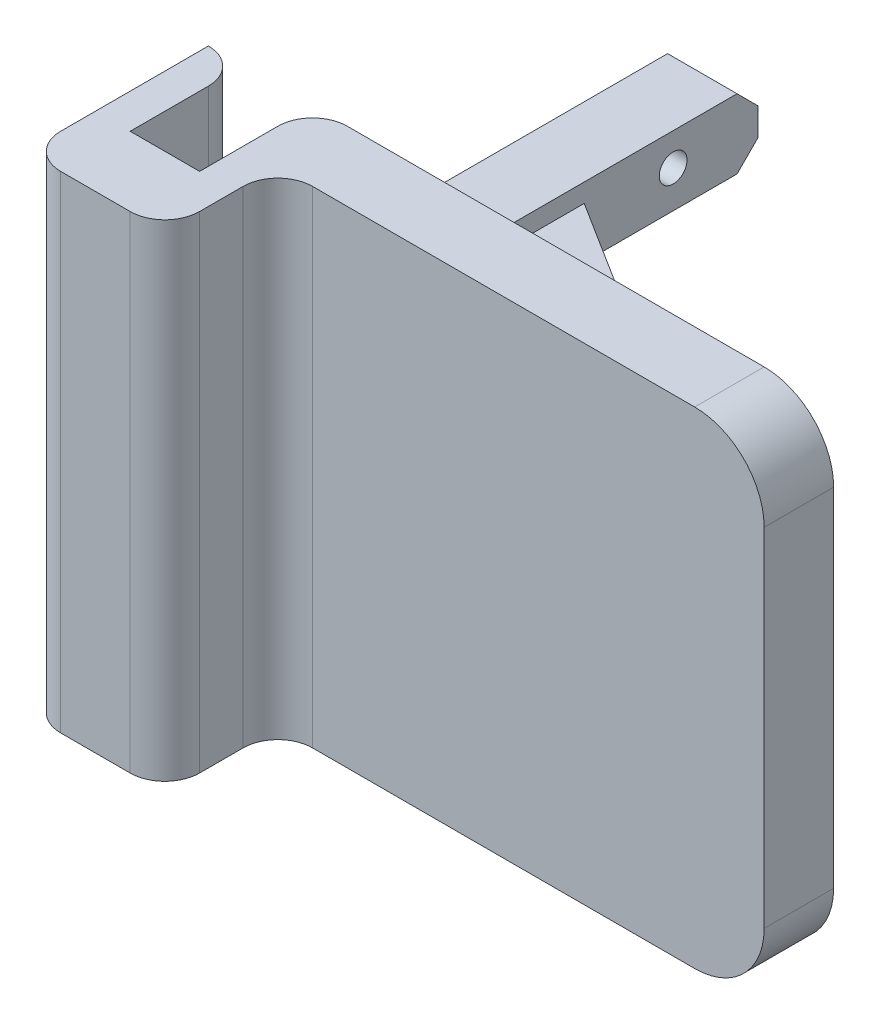
from build123d import *

# Parameters (mm, degrees)
ESQUISSE1_W             = 35
ESQUISSE1_H             = 35
BOSS_EXTRU_1_DEPTH      = 5
BOSS_EXTRU_2_DEPTH      = 13.13
ESQUISSE3_W             = 5
ESQUISSE3_H             = 35
BOSS_EXTRU_3_DEPTH      = 5
BOSS_EXTRU_4_START      = -19.05
ESQUISSE4_W             = 20.5
ESQUISSE4_H             = 4.65
BOSS_EXTRU_4_DEPTH      = 5
BOSS_EXTRU_5_START      = 27.4
ESQUISSE5_W             = 5
ESQUISSE5_H             = 20.5
BOSS_EXTRU_5_DEPTH      = 5
BOSS_EXTRU_6_START      = -1.1625
BOSS_EXTRU_6_DEPTH      = 2.325
BOSS_EXTRU_7_START      = 27.225
BOSS_EXTRU_7_DEPTH      = 2.325
CONG_3_R                = 5
CONG_4_R                = 1.3
CONG_5_R                = 5
ESQUISSE8_R             = 1
ENL_V_MAT_EXTRU_1_DEPTH = 38.415270946
CHANFREIN1_SIZE         = 1.5
CONG_6_R                = 5
CONG_7_R                = 2.5
CONG_8_R                = 2.5
CONG_9_R                = 2.5
ESQUISSE9_R             = 1.5
ENL_V_MAT_EXTRU_2_DEPTH = 51.326434406


# Some blends are built 0.0001 mm under size
with BuildPart() as part:
    # Esquisse1 → Boss.-Extru.1 (new body)
    with BuildSketch(Plane.XY):
        Rectangle(ESQUISSE1_W, ESQUISSE1_H)
    extrude(amount=BOSS_EXTRU_1_DEPTH)

    # Esquisse2 → Boss.-Extru.2 (add)
    with BuildSketch(Plane(origin=(0, 0, 0), x_dir=(-1, 0, 0), z_dir=(0, 0, -1))):
        Polygon((25, 15), (25, -15), (25, -17.5), (27.5, -17.5), (27.5, 17.5), (25, 17.5), align=None)
        Polygon((17.5, 17.5), (17.5, -17.5), (20, -17.5), (20, -15), (20, 15), (20, 17.5), align=None)
    extrude(amount=-BOSS_EXTRU_2_DEPTH)


with BuildPart() as boss_extru_2_piece_1:
    # of the separate pieces the step leaves, piece 1, a body of its own (boss_extru_2_pieces)
    add(part.part.solids().sort_by_distance((17.5, 17.5, 0))[0])



with BuildPart() as boss_extru_2_piece_2:
    # of the separate pieces the step leaves, piece 2, a body of its own (boss_extru_2_pieces)
    add(part.part.solids().sort_by_distance((-25, 17.5, 0))[0])


with BuildPart() as boss_extru_2_piece_1_1:
    add(boss_extru_2_piece_1.part)

    add(boss_extru_2_piece_2.part)  # Boss.-Extru.3 merges Boss.-Extru.2 piece 2
    # Esquisse3 → Boss.-Extru.3 (add)
    with BuildSketch(Plane.ZY.offset(20)):
        with Locations((10.63, 0)):
            Rectangle(ESQUISSE3_W, ESQUISSE3_H)
    extrude(amount=BOSS_EXTRU_3_DEPTH)

    # Esquisse4 → Boss.-Extru.4 (add)
    with BuildSketch(Plane.ZY.offset(27.5).offset(BOSS_EXTRU_4_START)):
        with Locations((-10.25, -15.175)):
            Rectangle(ESQUISSE4_W, ESQUISSE4_H)
    extrude(amount=BOSS_EXTRU_4_DEPTH)

    # Esquisse5 → Boss.-Extru.5 (add)
    with BuildSketch(Plane(origin=(0, -12.85, 0), x_dir=(1, 0, 0), z_dir=(0, 1, 0)).offset(BOSS_EXTRU_5_START)):
        with Locations((-10.95, 10.25)):
            Rectangle(ESQUISSE5_W, ESQUISSE5_H)
    extrude(amount=-BOSS_EXTRU_5_DEPTH)

    # Esquisse6 → Boss.-Extru.6 (add)
    with BuildSketch(Plane.XZ.offset(17.5).offset(BOSS_EXTRU_6_START)):
        Polygon((-8.45, -8), (4.23857754, 0), (-8.45, 0), align=None)
    extrude(amount=-BOSS_EXTRU_6_DEPTH)

    # Esquisse7 → Boss.-Extru.7 (add)
    with BuildSketch(Plane(origin=(0, -14.0125, 0), x_dir=(1, 0, 0), z_dir=(0, 1, 0)).offset(BOSS_EXTRU_7_START)):
        Polygon((-8.45, 8), (-8.45, 0), (4.23857754, 0), align=None)
    extrude(amount=-BOSS_EXTRU_7_DEPTH)

    # Congé3
    # the kernel refuses this fillet: 5 mm, written as the material it adds along each edge
    with BuildSketch(Plane(origin=(12.251689354, -16.3375, 0), x_dir=(0, -1, 0), z_dir=(-1, 0, 0))) as cong_3_piece_1_section:
        with BuildLine():
            CenterArc((5, -3.205244725), CONG_3_R, 140.129918766, 39.870081234)
            Line((0, -3.205244725), (0, 0))
            Line((0, 0), (1.1625, 0))
        make_face()
    cong_3_piece_1 = extrude(amount=20.701689354, mode=Mode.PRIVATE)
    cong_3_piece_1 = split(cong_3_piece_1, bisect_by=Plane(origin=(-0.976512405, -16.627700283, -3.288053324), z_dir=(-0.5333333333333334, 0, 0.8459051693633013)), keep=Keep.TOP, mode=Mode.PRIVATE)
    add(cong_3_piece_1)

    # Congé4
    cong_4_edges = [boss_extru_2_piece_1_1.edges().sort_by_distance(p)[0] for p in [
        (-2.10571123, 13.2125, 0),
    ]]
    fillet(cong_4_edges, radius=CONG_4_R)

    # Congé5
    cong_5_edges = [boss_extru_2_piece_1_1.edges().sort_by_distance(p)[0] for p in [
        (17.5, -17.5, 2.5),
        (17.5, 17.5, 2.5),
    ]]
    fillet(cong_5_edges, radius=CONG_5_R)

    # Esquisse8 → Enlèv. mat.-Extru.1 (cut, through all)
    with BuildSketch(Plane(origin=(-8.45, 0, 0), x_dir=(0, 0, -1), z_dir=(1, 0, 0))):
        with Locations(Location((14.4, 12.225, 0), (0, 0, 90))):
            Circle(ESQUISSE8_R)
        with Locations(Location((14.4, -15.175, 0), (0, 0, 90))):
            Circle(ESQUISSE8_R)
    extrude(amount=-ENL_V_MAT_EXTRU_1_DEPTH, mode=Mode.SUBTRACT)

    # Chanfrein1
    chanfrein1_edges = [boss_extru_2_piece_1_1.edges().sort_by_distance(p)[0] for p in [
        (-10.95, -12.85, -20.5),
        (-10.95, -17.5, -20.5),
        (-10.95, 9.55, -20.5),
        (-10.95, 14.55, -20.5),
    ]]
    chamfer(chanfrein1_edges, length=CHANFREIN1_SIZE)

    # Congé6
    cong_6_edges = [boss_extru_2_piece_1_1.edges().sort_by_distance(p)[0] for p in [
        (-10.95, -12.85, 0),
        (-10.95, 9.55, 0),
    ]]
    fillet(cong_6_edges, radius=CONG_6_R)

    # Congé7
    cong_7_edges = [boss_extru_2_piece_1_1.edges().sort_by_distance(p)[0] for p in [
        (-17.5, 0, 13.13),
        (-27.5, 0, 13.13),
    ]]
    fillet(cong_7_edges, radius=CONG_7_R)

    # Congé8
    cong_8_edges = [boss_extru_2_piece_1_1.edges().sort_by_distance(p)[0] for p in [
        (-17.5, 0, 5),
    ]]
    fillet(cong_8_edges, radius=CONG_8_R)

    # Congé9
    cong_9_edges = [boss_extru_2_piece_1_1.edges().sort_by_distance(p)[0] for p in [
        (-20, 0, 0),
        (-25, 0, 0),
    ]]
    fillet(cong_9_edges, radius=CONG_9_R - 0.0001)  # a hair under: the kernel refuses the full size

    # Esquisse9 → Enlèv. mat.-Extru.2 (cut, through all)
    with BuildSketch(Plane(origin=(-25, 0, 0), x_dir=(0, 0, -1), z_dir=(1, 0, 0))):
        with Locations((-5.315, -12)):
            Circle(ESQUISSE9_R)
        with Locations((-5.315, 12)):
            Circle(ESQUISSE9_R)
    extrude(amount=-ENL_V_MAT_EXTRU_2_DEPTH, mode=Mode.SUBTRACT)


solid = boss_extru_2_piece_1_1.part
